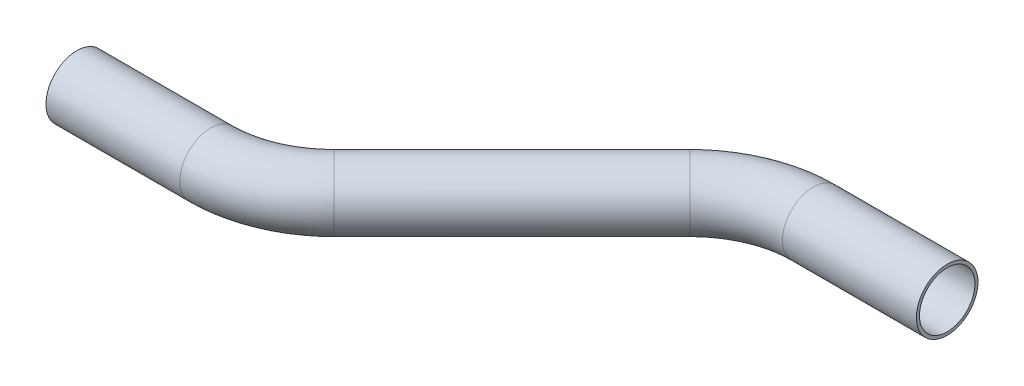
from build123d import *

# Parameters (mm, degrees)
SKETCH3_R   = 6.35
SKETCH3_R_2 = 5.715


with BuildPart() as part:
    # Sweep1: sweep along a path in Sketch2
    with BuildLine(Plane(origin=(0, 0, 0), x_dir=(1, 0, 0), z_dir=(0, 1, 0))) as sweep1_path:
        Line((0, 0), (27.578975516, 0))
        ThreePointArc((27.578975516, 0), (37.299134698, 1.933459874), (45.539487758, 7.439487758))
        Line((45.539487758, 7.439487758), (82.229370242, 44.129370242))
        ThreePointArc((82.229370242, 44.129370242), (90.469723302, 49.635398126), (100.189882484, 51.568858))
        Line((100.189882484, 51.568858), (127.768858, 51.568858))
    # Sketch3 → Sweep1 (sweep)
    with BuildSketch(Plane(origin=(0, 0, 0), x_dir=(0, 0, -1), z_dir=(1, 0, 0))):
        Circle(SKETCH3_R)
        Circle(SKETCH3_R_2, mode=Mode.SUBTRACT)
    sweep(path=sweep1_path.line)


solid = part.part
